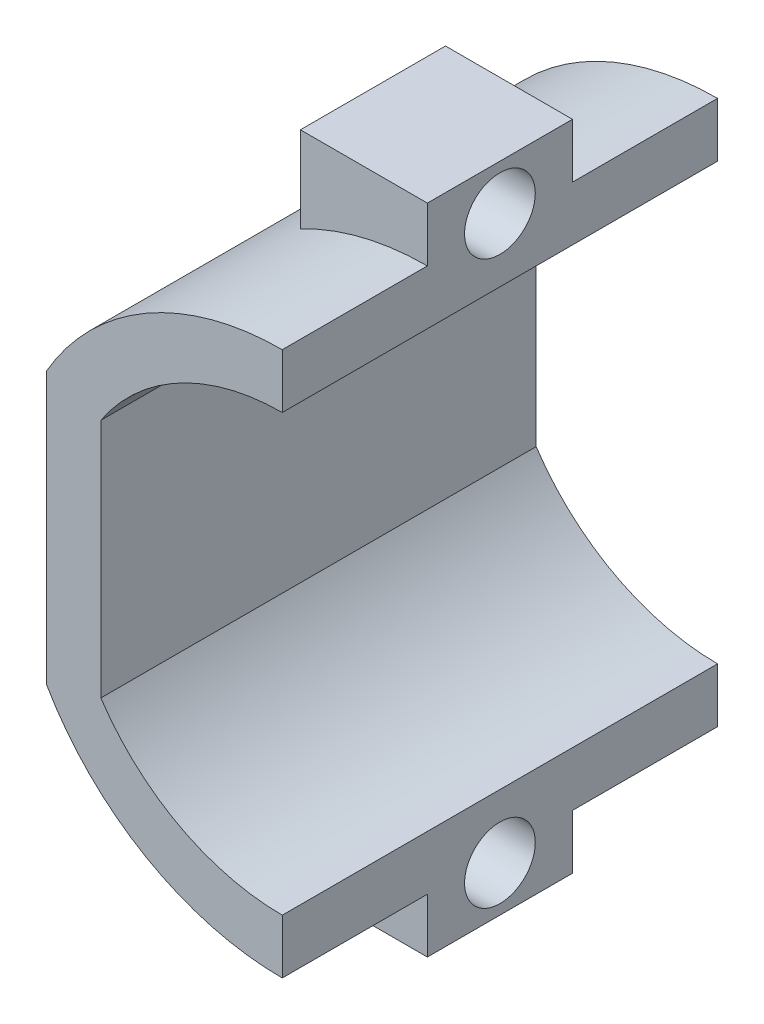
from build123d import *

# Parameters (mm, degrees)
BOSS_EXTRUDE2_DEPTH  = 12
BOSS_EXTRUDE3_START  = -12
BOSS_EXTRUDE3_DEPTH  = 12
CUT_EXTRUDE6_START   = -4
CUT_EXTRUDE6_DEPTH   = 4
CUT_EXTRUDE7_REACH   = 18.348
SKETCH4_R            = 0.975
MIRROR2_START        = -4
MIRROR2_COPY_1_DEPTH = 4


# Read off the part's stored shape, not the designer's step: Boss-Extrude3
with BuildPart() as part:
    # Sketch1 → Boss-Extrude2 (new body)
    with BuildSketch(Plane.XY):
        with BuildLine():
            Line((0, 6), (0, 7.5))
            ThreePointArc((0, 7.5), (-3.75510396, 6.492241081), (-6.501077384, 3.739785134))
            Line((-6.501077384, 3.739785134), (-6.501077384, -3.739785134))
            ThreePointArc((-6.501077384, -3.739785134), (-3.75510396, -6.492241081), (0, -7.5))
            Line((0, -7.5), (0, -6))
            ThreePointArc((0, -6), (-2.838133189, -5.286303056), (-5.001077384, -3.315))
            ThreePointArc((-5.001077384, -3.315), (-6, 0), (-5.001077384, 3.315))
            ThreePointArc((-5.001077384, 3.315), (-2.838133189, 5.286303056), (0, 6))
        make_face()
        with BuildLine():
            Line((-5.001077384, -3.315), (-5.001077384, 3.315))
            ThreePointArc((-5.001077384, 3.315), (-6, 0), (-5.001077384, -3.315))
        make_face()
    extrude(amount=BOSS_EXTRUDE2_DEPTH)

    # Boss-Extrude3 outline → Boss-Extrude3 (add)
    with BuildSketch(Plane.XY.offset(12).offset(BOSS_EXTRUDE3_START)):
        with BuildLine():
            ThreePointArc((-3.5, 6.633249581), (-1.802862744, 7.280088319), (0, 7.5))
            Line((0, 7.5), (0, 9))
            Line((0, 9), (-3.5, 9))
            Line((-3.5, 9), (-3.5, 6.633249581))
        make_face()
    boss_extrude3 = extrude(amount=BOSS_EXTRUDE3_DEPTH)

    # Sketch3 → Cut-Extrude6 (cut)
    with BuildSketch(Plane.XY.offset(12).offset(CUT_EXTRUDE6_START)):
        with BuildLine():
            Line((-4.617876388, 10.846765639), (-4.617876388, 5.909756142))
            ThreePointArc((-4.617876388, 5.909756142), (-1.858071818, 7.266193578), (1.214101671, 7.401078106))
            Line((1.214101671, 7.401078106), (1.214101671, 10.846765639))
            Line((1.214101671, 10.846765639), (-4.617876388, 10.846765639))
        make_face()
    cut_extrude6 = extrude(amount=CUT_EXTRUDE6_DEPTH, mode=Mode.SUBTRACT)

    # Mirror1: Cut-Extrude6 across plane
    add(cut_extrude6.mirror(Plane.XY.offset(6)), mode=Mode.SUBTRACT)

    # Sketch4 → Cut-Extrude7 (cut, up to next)
    with BuildSketch(Plane(origin=(0, 0, 0), x_dir=(0, 0, -1), z_dir=(1, 0, 0)), mode=Mode.PRIVATE) as cut_extrude7_sk1:
        with Locations((-6, 7.75)):
            Circle(SKETCH4_R)
    cut_extrude7_tool1 = extrude(cut_extrude7_sk1.sketch, amount=-CUT_EXTRUDE7_REACH, mode=Mode.PRIVATE) & part.part
    cut_extrude7 = cut_extrude7_tool1.solids().sort_by_distance((0, 7.75, 6))[0]
    add(cut_extrude7, mode=Mode.SUBTRACT)

    # Mirror2: Boss-Extrude3, Cut-Extrude6, Cut-Extrude7 across plane
    add(boss_extrude3.mirror(Plane.ZX))
    add(cut_extrude6.mirror(Plane.ZX), mode=Mode.SUBTRACT)
    add(cut_extrude7.mirror(Plane.ZX), mode=Mode.SUBTRACT)

    # Mirror2 copy 1 sketch → Mirror2 copy 1 (cut)
    with BuildSketch(Plane(origin=(0, 0, 0), x_dir=(1, 0, 0), z_dir=(0, 0, -1)).offset(MIRROR2_START)):
        with BuildLine():
            Line((-4.617876388, 10.846765639), (-4.617876388, 5.909756142))
            ThreePointArc((-4.617876388, 5.909756142), (-1.858071818, 7.266193578), (1.214101671, 7.401078106))
            Line((1.214101671, 7.401078106), (1.214101671, 10.846765639))
            Line((1.214101671, 10.846765639), (-4.617876388, 10.846765639))
        make_face()
    extrude(amount=MIRROR2_COPY_1_DEPTH, mode=Mode.SUBTRACT)


solid = part.part
